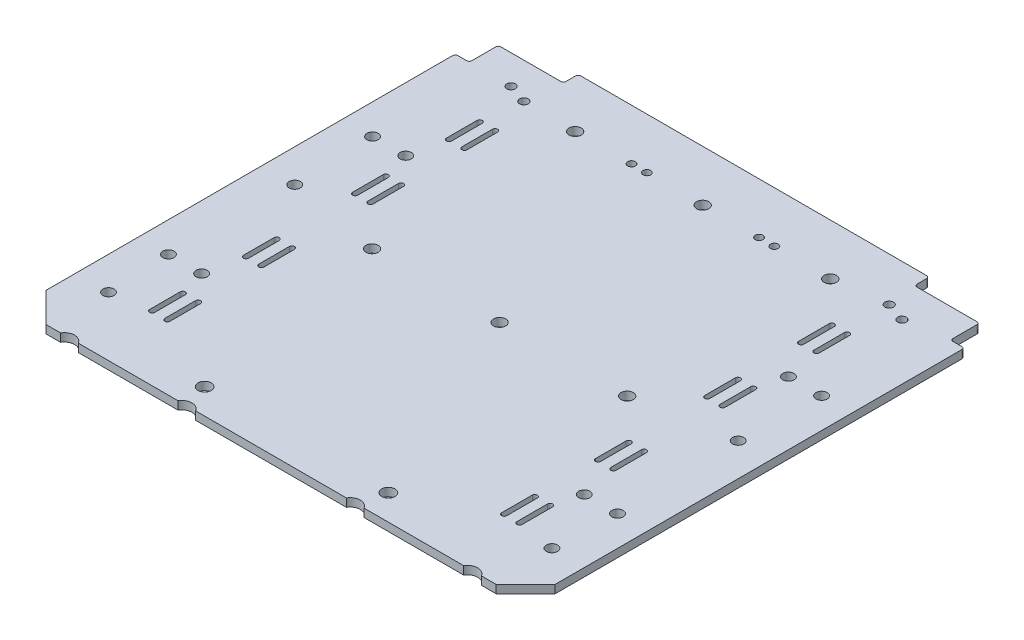
from build123d import *

# Parameters (mm, degrees)
GENERICCARDPCBDEFINITION_START = -0.8
GENERICCARDPCBDEFINITION_DEPTH = 1.6
SKETCH7_R                      = 1.1
SKETCH7_R_2                    = 1.2
SKETCH7_R_3                    = 1.3
SKETCH7_R_4                    = 0.85
SKETCH7_R_5                    = 0.75
CUT_EXTRUDE1_DEPTH             = 1.6


# Read off the part's stored shape, not the designer's step: GenericCardPCBDefinition
with BuildPart() as part:
    # GenericCardPCBDefinition outline → GenericCardPCBDefinition (new body)
    with BuildSketch(Plane(origin=(0, 0, 0), x_dir=(1, 0, 0), z_dir=(0, 1, 0)).offset(GENERICCARDPCBDEFINITION_START)):
        with BuildLine():
            Line((-49.9, -39), (-44.1, -44.8))
            Line((-44.1, -44.8), (-41.232050808, -44.8))
            ThreePointArc((-41.232050808, -44.8), (-39.5, -43.8), (-37.767949192, -44.8))
            Line((-37.767949192, -44.8), (-18.232050808, -44.8))
            ThreePointArc((-18.232050808, -44.8), (-16.5, -43.8), (-14.767949192, -44.8))
            Line((-14.767949192, -44.8), (14.767949192, -44.8))
            ThreePointArc((14.767949192, -44.8), (16.5, -43.8), (18.232050808, -44.8))
            Line((18.232050808, -44.8), (37.767949192, -44.8))
            ThreePointArc((37.767949192, -44.8), (39.5, -43.8), (41.232050808, -44.8))
            Line((41.232050808, -44.8), (44.1, -44.8))
            Line((44.1, -44.8), (49.9, -39))
            Line((49.9, -39), (49.9, 40.7))
            ThreePointArc((49.9, 40.7), (49.753553391, 41.053553391), (49.4, 41.2))
            Line((49.4, 41.2), (47.65, 41.2))
            ThreePointArc((47.65, 41.2), (47.296446609, 41.346446609), (47.15, 41.7))
            Line((47.15, 41.7), (47.15, 46.4))
            ThreePointArc((47.15, 46.4), (47.003553391, 46.753553391), (46.65, 46.9))
            Line((46.65, 46.9), (34.9, 46.9))
            ThreePointArc((34.9, 46.9), (34.546446609, 47.046446609), (34.4, 47.4))
            Line((34.4, 47.4), (34.4, 49.3))
            ThreePointArc((34.4, 49.3), (34.253553391, 49.653553391), (33.9, 49.8))
            Line((33.9, 49.8), (-33.9, 49.8))
            ThreePointArc((-33.9, 49.8), (-34.253553391, 49.653553391), (-34.4, 49.3))
            Line((-34.4, 49.3), (-34.4, 47.4))
            ThreePointArc((-34.4, 47.4), (-34.546446609, 47.046446609), (-34.9, 46.9))
            Line((-34.9, 46.9), (-46.65, 46.9))
            ThreePointArc((-46.65, 46.9), (-47.003553391, 46.753553391), (-47.15, 46.4))
            Line((-47.15, 46.4), (-47.15, 41.7))
            ThreePointArc((-47.15, 41.7), (-47.296446609, 41.346446609), (-47.65, 41.2))
            Line((-47.65, 41.2), (-49.4, 41.2))
            ThreePointArc((-49.4, 41.2), (-49.753553391, 41.053553391), (-49.9, 40.7))
            Line((-49.9, 40.7), (-49.9, -39))
        make_face()
    extrude(amount=GENERICCARDPCBDEFINITION_DEPTH)

    # Sketch7 → Cut-Extrude1 (cut)
    with BuildSketch(Plane(origin=(0, 0.8, 0), x_dir=(1, 0, 0), z_dir=(0, 1, 0))):
        with Locations(Location((-37.5, -20.899999999, 0), (0, 0, 270))):
            Circle(SKETCH7_R)
        with Locations(Location((-44, -20.899999999, 0), (0, 0, 270))):
            Circle(SKETCH7_R)
        with Locations(Location((25, 0, 0), (0, 0, 270))):
            Circle(SKETCH7_R_2)
        with Locations(Location((0, 0, 0), (0, 0, 270))):
            Circle(SKETCH7_R_2)
        with Locations(Location((-25, 0, 0), (0, 0, 270))):
            Circle(SKETCH7_R_2)
        with Locations(Location((0, 39.8, 0), (0, 0, 270))):
            Circle(SKETCH7_R_2)
        with Locations(Location((-25, 39.8, 0), (0, 0, 270))):
            Circle(SKETCH7_R_2)
        with Locations(Location((25, 39.8, 0), (0, 0, 270))):
            Circle(SKETCH7_R_2)
        with Locations(Location((18, -39.8, 0), (0, 0, 270))):
            Circle(SKETCH7_R_3)
        with Locations(Location((-18, -39.8, 0), (0, 0, 270))):
            Circle(SKETCH7_R_3)
        with Locations(Location((-37.5, 19.1, 0), (0, 0, 270))):
            Circle(SKETCH7_R)
        with Locations(Location((-44, 19.1, 0), (0, 0, 270))):
            Circle(SKETCH7_R)
        with Locations(Location((44, 19.1, 0), (0, 0, 270))):
            Circle(SKETCH7_R)
        with Locations(Location((37.5, 19.1, 0), (0, 0, 270))):
            Circle(SKETCH7_R)
        with Locations(Location((43.45, 3.3, 0), (0, 0, 270))):
            Circle(SKETCH7_R)
        with Locations(Location((37.5, -20.899999999, 0), (0, 0, 270))):
            Circle(SKETCH7_R)
        with Locations(Location((44, -20.899999999, 0), (0, 0, 270))):
            Circle(SKETCH7_R)
        with Locations(Location((43.45, -33.2, 0), (0, 0, 270))):
            Circle(SKETCH7_R)
        with Locations(Location((38.95, 39.9, 0), (0, 0, 270))):
            Circle(SKETCH7_R_4)
        with Locations(Location((35.15, 41.2, 0), (0, 0, 270))):
            Circle(SKETCH7_R_4)
        with Locations(Location((-35.15, 39.9, 0), (0, 0, 270))):
            Circle(SKETCH7_R_4)
        with Locations(Location((-38.95, 41.2, 0), (0, 0, 270))):
            Circle(SKETCH7_R_4)
        with Locations(Location((14, 39.85, 0), (0, 0, 270))):
            Circle(SKETCH7_R_5)
        with Locations(Location((11, 39.85, 0), (0, 0, 270))):
            Circle(SKETCH7_R_5)
        with Locations(Location((-11, 39.85, 0), (0, 0, 270))):
            Circle(SKETCH7_R_5)
        with Locations(Location((-14, 39.85, 0), (0, 0, 270))):
            Circle(SKETCH7_R_5)
        with Locations(Location((-43.45, 3.3, 0), (0, 0, 270))):
            Circle(SKETCH7_R)
        with Locations(Location((-43.45, -33.2, 0), (0, 0, 270))):
            Circle(SKETCH7_R)
        with BuildLine():
            Line((32.5, -32.1), (32.5, -26.1))
            ThreePointArc((32.5, -26.1), (33, -25.6), (33.5, -26.1))
            Line((33.5, -26.1), (33.5, -32.1))
            ThreePointArc((33.5, -32.1), (33, -32.6), (32.5, -32.1))
        make_face()
        with BuildLine():
            Line((35.5, -32.1), (35.5, -26.1))
            ThreePointArc((35.5, -26.1), (36, -25.6), (36.5, -26.1))
            Line((36.5, -26.1), (36.5, -32.1))
            ThreePointArc((36.5, -32.1), (36, -32.6), (35.5, -32.1))
        make_face()
        with BuildLine():
            Line((35.5, -13.7), (35.5, -7.7))
            ThreePointArc((35.5, -7.7), (36, -7.2), (36.5, -7.7))
            Line((36.5, -7.7), (36.5, -13.7))
            ThreePointArc((36.5, -13.7), (36, -14.2), (35.5, -13.7))
        make_face()
        with BuildLine():
            Line((32.5, -13.7), (32.5, -7.7))
            ThreePointArc((32.5, -7.7), (33, -7.2), (33.5, -7.7))
            Line((33.5, -7.7), (33.5, -13.7))
            ThreePointArc((33.5, -13.7), (33, -14.2), (32.5, -13.7))
        make_face()
        with BuildLine():
            Line((32.5, 32.1), (32.5, 26.1))
            ThreePointArc((32.5, 26.1), (33, 25.6), (33.5, 26.1))
            Line((33.5, 26.1), (33.5, 32.1))
            ThreePointArc((33.5, 32.1), (33, 32.6), (32.5, 32.1))
        make_face()
        with BuildLine():
            Line((35.5, 32.1), (35.5, 26.1))
            ThreePointArc((35.5, 26.1), (36, 25.6), (36.5, 26.1))
            Line((36.5, 26.1), (36.5, 32.1))
            ThreePointArc((36.5, 32.1), (36, 32.6), (35.5, 32.1))
        make_face()
        with BuildLine():
            Line((35.5, 13.7), (35.5, 7.7))
            ThreePointArc((35.5, 7.7), (36, 7.2), (36.5, 7.7))
            Line((36.5, 7.7), (36.5, 13.7))
            ThreePointArc((36.5, 13.7), (36, 14.2), (35.5, 13.7))
        make_face()
        with BuildLine():
            Line((32.5, 13.7), (32.5, 7.7))
            ThreePointArc((32.5, 7.7), (33, 7.2), (33.5, 7.7))
            Line((33.5, 7.7), (33.5, 13.7))
            ThreePointArc((33.5, 13.7), (33, 14.2), (32.5, 13.7))
        make_face()
        with BuildLine():
            Line((-32.5, 13.7), (-32.5, 7.7))
            ThreePointArc((-32.5, 7.7), (-33, 7.2), (-33.5, 7.7))
            Line((-33.5, 7.7), (-33.5, 13.7))
            ThreePointArc((-33.5, 13.7), (-33, 14.2), (-32.5, 13.7))
        make_face()
        with BuildLine():
            Line((-35.5, 13.7), (-35.5, 7.7))
            ThreePointArc((-35.5, 7.7), (-36, 7.2), (-36.5, 7.7))
            Line((-36.5, 7.7), (-36.5, 13.7))
            ThreePointArc((-36.5, 13.7), (-36, 14.2), (-35.5, 13.7))
        make_face()
        with BuildLine():
            Line((-35.5, 32.1), (-35.5, 26.1))
            ThreePointArc((-35.5, 26.1), (-36, 25.6), (-36.5, 26.1))
            Line((-36.5, 26.1), (-36.5, 32.1))
            ThreePointArc((-36.5, 32.1), (-36, 32.6), (-35.5, 32.1))
        make_face()
        with BuildLine():
            Line((-32.5, 32.1), (-32.5, 26.1))
            ThreePointArc((-32.5, 26.1), (-33, 25.6), (-33.5, 26.1))
            Line((-33.5, 26.1), (-33.5, 32.1))
            ThreePointArc((-33.5, 32.1), (-33, 32.6), (-32.5, 32.1))
        make_face()
        with BuildLine():
            Line((-32.5, -13.7), (-32.5, -7.7))
            ThreePointArc((-32.5, -7.7), (-33, -7.2), (-33.5, -7.7))
            Line((-33.5, -7.7), (-33.5, -13.7))
            ThreePointArc((-33.5, -13.7), (-33, -14.2), (-32.5, -13.7))
        make_face()
        with BuildLine():
            Line((-35.5, -13.7), (-35.5, -7.7))
            ThreePointArc((-35.5, -7.7), (-36, -7.2), (-36.5, -7.7))
            Line((-36.5, -7.7), (-36.5, -13.7))
            ThreePointArc((-36.5, -13.7), (-36, -14.2), (-35.5, -13.7))
        make_face()
        with BuildLine():
            Line((-35.5, -32.1), (-35.5, -26.1))
            ThreePointArc((-35.5, -26.1), (-36, -25.6), (-36.5, -26.1))
            Line((-36.5, -26.1), (-36.5, -32.1))
            ThreePointArc((-36.5, -32.1), (-36, -32.6), (-35.5, -32.1))
        make_face()
        with BuildLine():
            Line((-32.5, -32.1), (-32.5, -26.1))
            ThreePointArc((-32.5, -26.1), (-33, -25.6), (-33.5, -26.1))
            Line((-33.5, -26.1), (-33.5, -32.1))
            ThreePointArc((-33.5, -32.1), (-33, -32.6), (-32.5, -32.1))
        make_face()
    extrude(amount=-CUT_EXTRUDE1_DEPTH, mode=Mode.SUBTRACT)


solid = part.part
